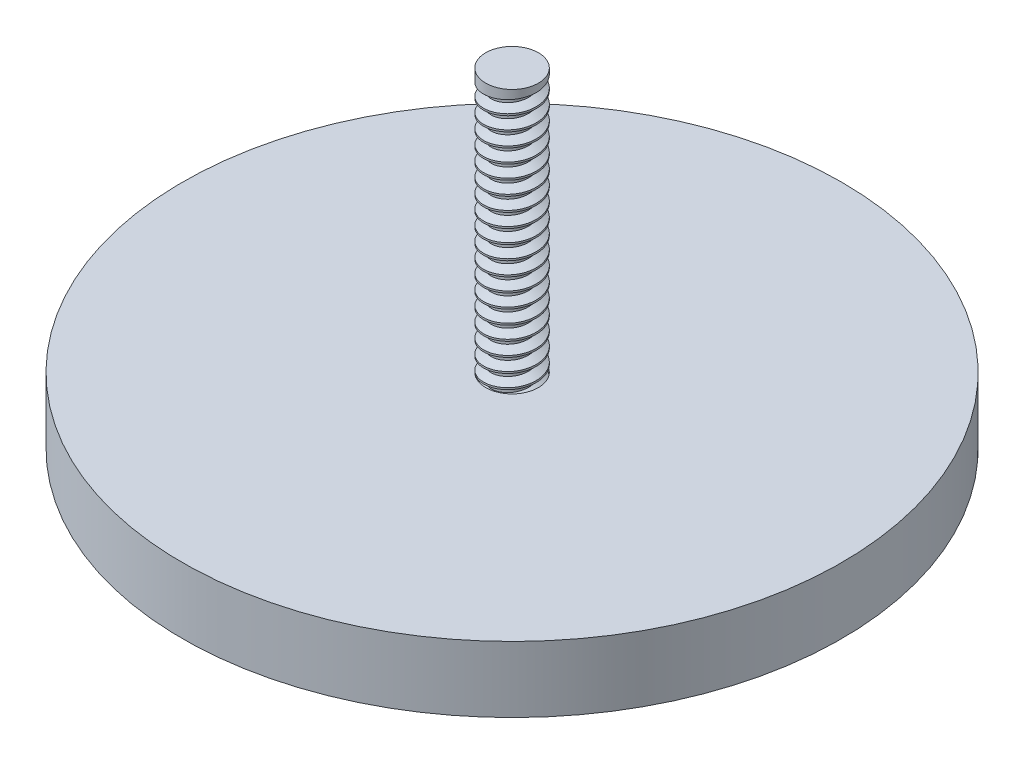
from build123d import *
from build123d.topology import SkipClean

# Parameters (mm, degrees)
THREAD1_PITCH = 1.058333333


with BuildPart() as part:
    # Sketch1 → Revolve1 (revolve)
    with BuildSketch(Plane.XY, mode=Mode.PRIVATE) as revolve1_sk:
        Polygon((-25, 0), (0, 0), (0, 25), (-2, 25), (-2, 5), (-25, 5), align=None)
    revolve(revolve1_sk.sketch.rotate(Axis((0, 0, 0), (0, 1, 0)), 270), axis=Axis((0, 0, 0), (0, 1, 0)))

    # Thread1: the profile of Thread Profile1 profile screwed along a right-hand helix of 18.897638 turns, 8 arcs to a turn; built about Z, then put on its axis
    with SkipClean():  # the faces are left unmerged after this step: merging them gives an invalid solid
        thread1_z = Axis((0, 0, 0), (0, 0, 1))
        thread1_corners = [(2.0003, 0, -0.000173205), (2.0003, 0, 0.926214869), (1.427160282, 0, 0.595312499), (1.427160282, 0, 0.330729165)]
        with BuildLine(mode=Mode.PRIVATE) as thread1_profile:
            Line(thread1_corners[0], thread1_corners[1])
            Line(thread1_corners[1], thread1_corners[2])
            Line(thread1_corners[2], thread1_corners[3])
            Line(thread1_corners[3], thread1_corners[0])
        thread1_cap = Face(thread1_profile.wire())
        thread1_turn_angles = [0, 22.5, 45, 67.5, 90, 112.5, 135, 157.5, 180, 202.5, 225, 247.5, 270, 292.5, 315, 337.5, 360]
        thread1_turn_weights = [1, 0.9238795325112867, 1, 0.9238795325112867, 1, 0.9238795325112867, 1, 0.9238795325112867, 1, 0.9238795325112867, 1, 0.9238795325112867, 1, 0.9238795325112867, 1, 0.9238795325112867, 1]
        thread1_turn_rails = [Edge.make_bspline([Vector(p[0], p[1], 0).rotate(thread1_z, thread1_turn_angles[k]) / thread1_turn_weights[k] + Vector(0, 0, p[2] + THREAD1_PITCH * thread1_turn_angles[k] / 360) for k in range(17)], [0, 0, 0, 1, 1, 2, 2, 3, 3, 4, 4, 5, 5, 6, 6, 7, 7, 8, 8, 8], 2, thread1_turn_weights) for p in thread1_corners]
        thread1_turn_sides = [Face.make_surface_from_curves(thread1_turn_rails[p[0]], thread1_turn_rails[p[1]]) for p in [(0, 1), (1, 2), (2, 3), (3, 0)]]
        thread1_last_angles = [6480, 6502.5, 6525, 6547.5, 6570, 6592.5, 6615, 6637.5, 6660, 6682.5, 6705, 6727.5, 6750, 6772.5, 6795, 6799.07480315, 6803.149606299]
        thread1_last_weights = [1, 0.9238795325112867, 1, 0.9238795325112867, 1, 0.9238795325112867, 1, 0.9238795325112867, 1, 0.9238795325112867, 1, 0.9238795325112867, 1, 0.9238795325112867, 1, 0.9974721287675905, 1]
        thread1_last_rails = [Edge.make_bspline([Vector(p[0], p[1], 0).rotate(thread1_z, thread1_last_angles[k]) / thread1_last_weights[k] + Vector(0, 0, p[2] + THREAD1_PITCH * thread1_last_angles[k] / 360) for k in range(17)], [0, 0, 0, 1, 1, 2, 2, 3, 3, 4, 4, 5, 5, 6, 6, 7, 7, 8, 8, 8], 2, thread1_last_weights) for p in thread1_corners]
        thread1_last_sides = [Face.make_surface_from_curves(thread1_last_rails[p[0]], thread1_last_rails[p[1]]) for p in [(0, 1), (1, 2), (2, 3), (3, 0)]]
        thread1 = Plane(origin=(0, 25, 0), x_dir=(-1, 0, 0), z_dir=(0, -1, 0)) * Solid(Shell([*[p.moved(Location((0, 0, THREAD1_PITCH * i))) for i in range(18) for p in thread1_turn_sides], *thread1_last_sides, thread1_cap, thread1_cap.rotate(thread1_z, 6803.149606299).moved(Location((0, 0, THREAD1_PITCH * 6803.149606299 / 360)))]))
        add(thread1, mode=Mode.SUBTRACT)


solid = part.part
